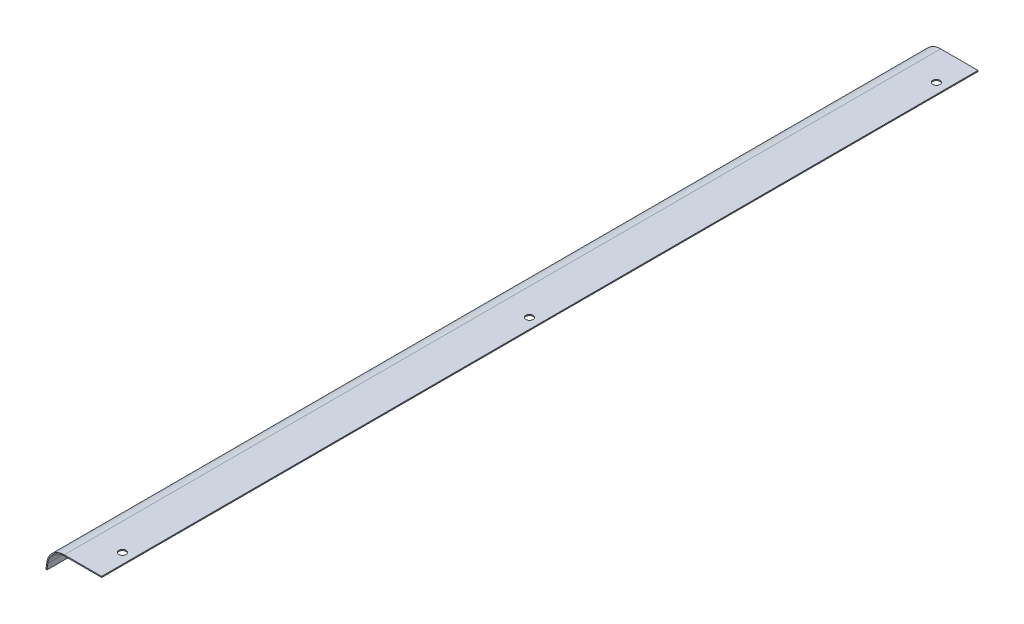
from build123d import *

# Parameters (mm, degrees)
BASE_FLANGE1_DEPTH = 211
SKETCH2_R          = 1.75
EXTRUDE1_DEPTH     = 0.5


# Sheet-metal steps are written as plain solids
with BuildPart() as part:
    # Sketch1 → Base-Flange1 (new, symmetric)
    with BuildSketch(Plane.XY):
        with BuildLine():
            Line((0, 0), (-18, 0))
            ThreePointArc((-18, 0), (-23.291502622, -2), (-25.937253933, -7))
            Line((-25.937253933, -7), (-26.312253933, -9.976470225))
            Line((-26.312253933, -9.976470225), (-26.808332304, -9.913970225))
            Line((-26.808332304, -9.913970225), (-26.433332304, -6.9375))
            ThreePointArc((-26.433332304, -6.9375), (-23.622221536, -1.625), (-18, 0.5))
            Line((-18, 0.5), (0, 0.5))
            Line((0, 0.5), (0, 0))
        make_face()
    extrude(amount=BASE_FLANGE1_DEPTH, both=True)

    # Sketch2 → Extrude1 (cut)
    with BuildSketch(Plane(origin=(0, 0.5, 0), x_dir=(1, 0, 0), z_dir=(0, 1, 0))):
        with Locations(Location((-5, -196, 0), (0, 0, 180))):
            Circle(SKETCH2_R)
        with Locations((-5, 196)):
            Circle(SKETCH2_R)
        with Locations(Location((-5, 0, 0), (0, 0, 180))):
            Circle(SKETCH2_R)
    extrude(amount=-EXTRUDE1_DEPTH, mode=Mode.SUBTRACT)


solid = part.part
